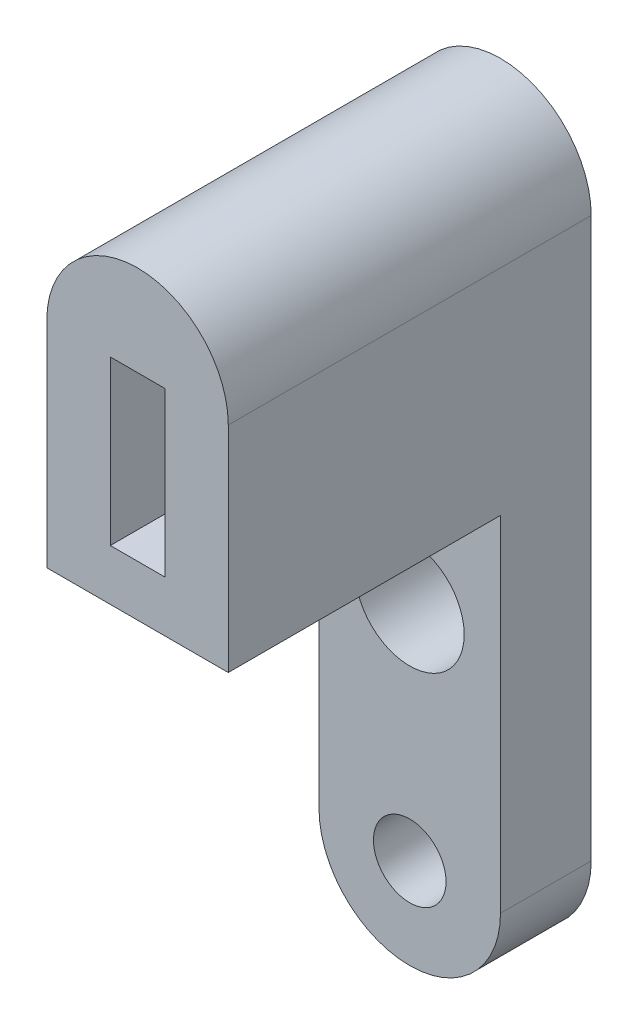
from build123d import *

# Parameters (mm, degrees)
SKETCH1_R           = 2
SKETCH1_R_2         = 3
SKETCH1_W           = 3
SKETCH1_H           = 9
BOSS_EXTRUDE1_DEPTH = 5
SKETCH1_4_W         = 3
SKETCH1_4_H         = 9
BOSS_EXTRUDE2_DEPTH = 20


with BuildPart() as part:
    # Sketch1 → Boss-Extrude1 (new body)
    with BuildSketch(Plane.XY):
        with BuildLine():
            ThreePointArc((-5, -17.71207008), (0, -22.71207008), (5, -17.71207008))
            Line((5, -17.71207008), (5, 13.08792992))
            ThreePointArc((5, 13.08792992), (0, 18.08792992), (-5, 13.08792992))
            Line((-5, 13.08792992), (-5, -17.71207008))
        make_face()
        with Locations((0, -17.71207008)):
            Circle(SKETCH1_R, mode=Mode.SUBTRACT)
        with Locations((0, -5.41207008)):
            Circle(SKETCH1_R_2, mode=Mode.SUBTRACT)
        with Locations((0, 8.58792992)):
            Rectangle(SKETCH1_W, SKETCH1_H, mode=Mode.SUBTRACT)
    extrude(amount=BOSS_EXTRUDE1_DEPTH)

    # Sketch1<4> → Boss-Extrude2 (add)
    with BuildSketch(Plane.XY):
        with BuildLine():
            Line((-5, 13.08792992), (-5, 1.276325687))
            Line((-5, 1.276325687), (5, 1.276325687))
            Line((5, 1.276325687), (5, 13.08792992))
            ThreePointArc((5, 13.08792992), (0, 18.08792992), (-5, 13.08792992))
        make_face()
        with Locations((0, 8.58792992)):
            Rectangle(SKETCH1_4_W, SKETCH1_4_H, mode=Mode.SUBTRACT)
    extrude(amount=BOSS_EXTRUDE2_DEPTH)


solid = part.part
